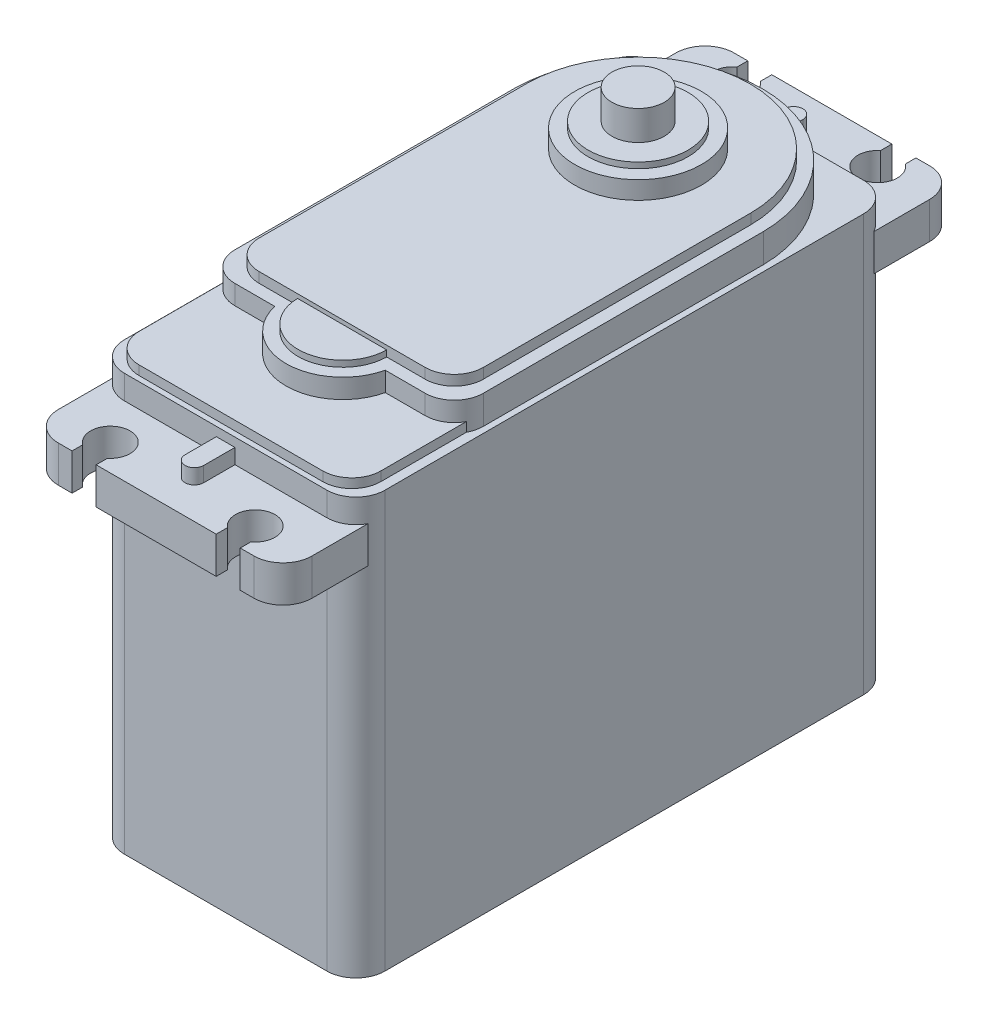
from build123d import *

# Parameters (mm, degrees)
SKETCH1_W            = 58.6486
SKETCH1_H            = 45.5168
BOSS_EXTRUDE1_DEPTH  = 28.4734
BOSS_EXTRUDE2_DEPTH  = 1.016
BOSS_EXTRUDE3_DEPTH  = 2.1209
SKETCH4_W            = 27.7241
SKETCH4_H            = 4.0005
BOSS_EXTRUDE4_DEPTH  = 7.5946
CUT_EXTRUDE1_DEPTH   = 62.365122174
CUT_EXTRUDE2_DEPTH   = 62.365122174
BOSS_EXTRUDE5_DEPTH  = 2.1209
BOSS_EXTRUDE6_DEPTH  = 1.6383
BOSS_EXTRUDE7_DEPTH  = 1.1176
BOSS_EXTRUDE8_DEPTH  = 0.6731
SKETCH11_W           = 7.4422
SKETCH11_H           = 3.4798
BOSS_EXTRUDE9_DEPTH  = 6.1214
BOSS_EXTRUDE9_TAPER  = 10
SKETCH12_W           = 27.7241
SKETCH12_H           = 4.0005
BOSS_EXTRUDE10_DEPTH = 7.5946
SKETCH13_W           = 2.159
SKETCH13_H           = 4.0005
SKETCH14_W           = 2.159
SKETCH14_H           = 4.0005
FILLET1_R            = 3.175
FILLET2_R            = 3.175
FILLET3_R            = 3.175
FILLET4_R            = 3.175
FILLET5_R            = 3.175
FILLET6_R            = 3.175
FILLET7_R            = 3.175
FILLET8_R            = 3.175
FILLET9_R            = 3.175
FILLET10_R           = 3.175
FILLET11_R           = 3.175
FILLET12_R           = 3.175


with BuildPart() as part:
    # Sketch1 → Boss-Extrude1 (new body)
    with BuildSketch(Plane(origin=(28.4734, 0, 0), x_dir=(0, 0, -1), z_dir=(1, 0, 0))):
        with Locations((8.645766261, -5.235024912)):
            Rectangle(SKETCH1_W, SKETCH1_H)
    extrude(amount=-BOSS_EXTRUDE1_DEPTH)

    # Sketch2 → Boss-Extrude2 (add)
    with BuildSketch(Plane(origin=(0, 17.523375088, 0), x_dir=(-1, 0, 0), z_dir=(0, 1, 0))):
        with BuildLine():
            Line((-27.4447, 20.100683739), (-1.0287, 20.100683739))
            Line((-1.0287, 20.100683739), (-1.0287, 7.58320464))
            ThreePointArc((-1.0287, 7.58320464), (-0.753850268, 6.863574994), (-0.6604, 6.098933739))
            Line((-0.6604, 6.098933739), (-0.6604, -24.497394688))
            ThreePointArc((-0.6604, -24.497394688), (-3.369851934, -32.532062726), (-10.317940007, -37.392216261))
            Line((-10.317940007, -37.392216261), (-18.155459993, -37.392216261))
            ThreePointArc((-18.155459993, -37.392216261), (-25.103548066, -32.532062726), (-27.813, -24.497394688))
            Line((-27.813, -24.497394688), (-27.813, 6.098933739))
            ThreePointArc((-27.813, 6.098933739), (-27.719549732, 6.863574994), (-27.4447, 7.58320464))
            Line((-27.4447, 7.58320464), (-27.4447, 20.100683739))
        make_face()
    extrude(amount=BOSS_EXTRUDE2_DEPTH)

    # Sketch3 → Boss-Extrude3 (add)
    with BuildSketch(Plane(origin=(0, 18.539375088, 0), x_dir=(-1, 0, 0), z_dir=(0, 1, 0))):
        with BuildLine():
            Line((-0.6604, 6.098933739), (-0.6604, -24.497394688))
            ThreePointArc((-0.6604, -24.497394688), (-14.2367, -37.970066261), (-27.813, -24.497394688))
            Line((-27.813, -24.497394688), (-27.813, 6.098933739))
            ThreePointArc((-27.813, 6.098933739), (-26.88306403, 8.343997769), (-24.638, 9.273933739))
            Line((-24.638, 9.273933739), (-3.8354, 9.273933739))
            ThreePointArc((-3.8354, 9.273933739), (-1.59033597, 8.343997769), (-0.6604, 6.098933739))
        make_face()
    extrude(amount=BOSS_EXTRUDE3_DEPTH)

    # Sketch4 → Boss-Extrude4 (add)
    with BuildSketch(Plane.XY.offset(20.678533739)):
        with Locations((14.2367, 12.906925088)):
            Rectangle(SKETCH4_W, SKETCH4_H)
    extrude(amount=BOSS_EXTRUDE4_DEPTH)

    # Sketch5 → Cut-Extrude1 (cut, through all)
    with BuildSketch(Plane.XZ.offset(-10.906675088)):
        with BuildLine():
            Line((7.67715, 28.273133739), (5.04825, 28.273133739))
            Line((5.04825, 28.273133739), (5.04825, 27.110795078))
            ThreePointArc((5.04825, 27.110795078), (6.374292493, 27.523106251), (7.67715, 27.042532099))
            Line((7.67715, 27.042532099), (7.67715, 28.273133739))
        make_face()
    cut_extrude1 = extrude(amount=-CUT_EXTRUDE1_DEPTH, mode=Mode.SUBTRACT)

    # Sketch6 → Cut-Extrude2 (cut, through all)
    with BuildSketch(Plane.XZ.offset(-10.906675088)):
        with BuildLine():
            Line((23.42515, 28.273133739), (20.79625, 28.273133739))
            Line((20.79625, 28.273133739), (20.79625, 27.042532099))
            ThreePointArc((20.79625, 27.042532099), (22.099107507, 27.523106251), (23.42515, 27.110795078))
            Line((23.42515, 27.110795078), (23.42515, 28.273133739))
        make_face()
    cut_extrude2 = extrude(amount=-CUT_EXTRUDE2_DEPTH, mode=Mode.SUBTRACT)

    # Sketch7 → Boss-Extrude5 (add)
    with BuildSketch(Plane(origin=(0, 18.539375088, 0), x_dir=(-1, 0, 0), z_dir=(0, 1, 0))):
        with BuildLine():
            Line((-8.19860123, 9.273933739), (-20.27479877, 9.273933739))
            ThreePointArc((-20.27479877, 9.273933739), (-14.2367, 14.074533739), (-8.19860123, 9.273933739))
        make_face()
    extrude(amount=BOSS_EXTRUDE5_DEPTH)

    # Sketch8 → Boss-Extrude6 (add)
    with BuildSketch(Plane(origin=(0, 14.907175088, 0), x_dir=(-1, 0, 0), z_dir=(0, 1, 0))):
        with BuildLine():
            Line((-13.2207, 24.094833739), (-13.2207, 20.678533739))
            Line((-13.2207, 20.678533739), (-15.2527, 20.678533739))
            Line((-15.2527, 20.678533739), (-15.2527, 24.094833739))
            ThreePointArc((-15.2527, 24.094833739), (-14.2367, 25.110833739), (-13.2207, 24.094833739))
        make_face()
    boss_extrude6 = extrude(amount=BOSS_EXTRUDE6_DEPTH)

    # Sketch9 → Boss-Extrude7 (add)
    with BuildSketch(Plane(origin=(0, 20.660275088, 0), x_dir=(-1, 0, 0), z_dir=(0, 1, 0))):
        with BuildLine():
            Line((-26.48585, -24.492179461), (-26.48585, 7.946783739))
            Line((-26.48585, 7.946783739), (-1.98755, 7.946783739))
            Line((-1.98755, 7.946783739), (-1.98755, -24.492179461))
            ThreePointArc((-1.98755, -24.492179461), (-14.2367, -36.642916261), (-26.48585, -24.492179461))
        make_face()
    extrude(amount=BOSS_EXTRUDE7_DEPTH)

    # Sketch10 → Boss-Extrude8 (add)
    with BuildSketch(Plane(origin=(0, 20.660275088, 0), x_dir=(-1, 0, 0), z_dir=(0, 1, 0))):
        with BuildLine():
            Line((-9.366750906, 7.946783739), (-19.106649094, 7.946783739))
            ThreePointArc((-19.106649094, 7.946783739), (-14.2367, 12.747383739), (-9.366750906, 7.946783739))
        make_face()
    extrude(amount=BOSS_EXTRUDE8_DEPTH)

    # Sketch11 → Boss-Extrude9 (add)
    with BuildSketch(Plane(origin=(0, 0, -37.970066261), x_dir=(-1, 0, 0), z_dir=(0, 0, -1))):
        with Locations((-14.2367, -22.684824912)):
            Rectangle(SKETCH11_W, SKETCH11_H)
    extrude(amount=BOSS_EXTRUDE9_DEPTH, taper=BOSS_EXTRUDE9_TAPER)

    # Sketch12 → Boss-Extrude10 (add)
    with BuildSketch(Plane(origin=(0, 0, -37.970066261), x_dir=(-1, 0, 0), z_dir=(0, 0, -1))):
        with Locations((-14.2367, 12.906925088)):
            Rectangle(SKETCH12_W, SKETCH12_H)
    extrude(amount=BOSS_EXTRUDE10_DEPTH)

    # Sketch13 → Cut-Revolve1 (revolve, cut)
    with BuildSketch(Plane.XY.offset(25.364833739)):
        with Locations((7.39775, 12.906925088)):
            Rectangle(SKETCH13_W, SKETCH13_H)
    cut_revolve1 = revolve(axis=Axis((6.31825, 14.907175088, 25.364833739), (0, -1, 0)), mode=Mode.SUBTRACT)

    # Sketch14 → Cut-Revolve2 (revolve, cut)
    with BuildSketch(Plane.XY.offset(25.364833739)):
        with Locations((23.23465, 12.906925088)):
            Rectangle(SKETCH14_W, SKETCH14_H)
    cut_revolve2 = revolve(axis=Axis((22.15515, 14.907175088, 25.364833739), (0, -1, 0)), mode=Mode.SUBTRACT)

    # Sketch15 → Revolve1 (revolve)
    with BuildSketch(Plane.XY.offset(-24.393367719)):
        Polygon((17.0942, 27.594475088), (14.2367, 27.594475088), (14.2367, 21.777875088), (21.16455, 21.777875088), (21.16455, 23.733675088), (19.6977, 23.733675088), (19.6977, 24.368675088), (17.0942, 24.368675088), align=None)
    revolve(axis=Axis((14.2367, 27.594475088, -24.393367719), (0, -1, 0)))

    # Fillet1
    fillet1_edges = [part.edges().sort_by_distance(p)[0] for p in [
        (27.4447, 18.031375088, 20.100683739),
    ]]
    fillet(fillet1_edges, radius=FILLET1_R)

    # Fillet2
    fillet2_edges = [part.edges().sort_by_distance(p)[0] for p in [
        (1.0287, 18.031375088, 20.100683739),
    ]]
    fillet(fillet2_edges, radius=FILLET2_R)

    # Fillet3
    # the kernel refuses this fillet: 3.175 mm, written as the material it takes off along each edge
    with BuildSketch(Plane(origin=(0, -35.930924912, -37.970066261), x_dir=(1, 0, 0), z_dir=(0, 1, 0))) as fillet3_piece_1_section:
        with BuildLine():
            CenterArc((FILLET3_R, -FILLET3_R), FILLET3_R, 90, 90)
            Line((0, -FILLET3_R), (0, 0))
            Line((0, 0), (FILLET3_R, 0))
        make_face()
    fillet3_piece_1 = extrude(amount=61.3918, mode=Mode.PRIVATE)
    fillet3_piece_1 = split(fillet3_piece_1, bisect_by=Plane(origin=(1.118801035, 10.906675088, -37.559986199), z_dir=(0, -1, 0)), keep=Keep.TOP, mode=Mode.PRIVATE)
    fillet3_piece_1 = split(fillet3_piece_1, bisect_by=Plane(origin=(0.37465, -12.512124912, -37.559986199), z_dir=(1, 0, 0)), keep=Keep.TOP, mode=Mode.PRIVATE)
    add(fillet3_piece_1, mode=Mode.SUBTRACT)
    with BuildSketch(Plane(origin=(0, -35.930924912, -37.970066261), x_dir=(1, 0, 0), z_dir=(0, 1, 0))) as fillet3_piece_2_section:
        with BuildLine():
            CenterArc((FILLET3_R, -FILLET3_R), FILLET3_R, 90, 90)
            Line((0, -FILLET3_R), (0, 0))
            Line((0, 0), (FILLET3_R, 0))
        make_face()
    fillet3_piece_2 = extrude(amount=61.3918, mode=Mode.PRIVATE)
    fillet3_piece_2 = split(fillet3_piece_2, bisect_by=Plane(origin=(0.130694491, 10.906675088, -36.797348053), z_dir=(0, -1, 0)), keep=Keep.TOP, mode=Mode.PRIVATE)
    fillet3_piece_2 = split(fillet3_piece_2, bisect_by=Plane(origin=(0.37465, -12.512124912, -36.797348053), z_dir=(-1, 0, 0)), keep=Keep.TOP, mode=Mode.PRIVATE)
    add(fillet3_piece_2, mode=Mode.SUBTRACT)
    with BuildSketch(Plane(origin=(0, -35.930924912, -37.970066261), x_dir=(1, 0, 0), z_dir=(0, 1, 0))) as fillet3_piece_3_section:
        with BuildLine():
            CenterArc((FILLET3_R, -FILLET3_R), FILLET3_R, 90, 90)
            Line((0, -FILLET3_R), (0, 0))
            Line((0, 0), (FILLET3_R, 0))
        make_face()
    fillet3_piece_3 = extrude(amount=61.3918, mode=Mode.PRIVATE)
    fillet3_piece_3 = split(fillet3_piece_3, bisect_by=Plane(origin=(0.130694491, 10.906675088, -36.797348053), z_dir=(0, 1, 0)), keep=Keep.TOP, mode=Mode.PRIVATE)
    fillet3_piece_3 = split(fillet3_piece_3, bisect_by=Plane(origin=(0.37465, 12.906925088, -36.797348053), z_dir=(-1, 0, 0)), keep=Keep.TOP, mode=Mode.PRIVATE)
    fillet3_piece_3 = split(fillet3_piece_3, bisect_by=Plane(origin=(0.130694491, 14.907175088, -36.797348053), z_dir=(0, -1, 0)), keep=Keep.TOP, mode=Mode.PRIVATE)
    add(fillet3_piece_3, mode=Mode.SUBTRACT)
    with BuildSketch(Plane(origin=(0, -35.930924912, -37.970066261), x_dir=(1, 0, 0), z_dir=(0, 1, 0))) as fillet3_piece_4_section:
        with BuildLine():
            CenterArc((FILLET3_R, -FILLET3_R), FILLET3_R, 90, 90)
            Line((0, -FILLET3_R), (0, 0))
            Line((0, 0), (FILLET3_R, 0))
        make_face()
    fillet3_piece_4 = extrude(amount=61.3918, mode=Mode.PRIVATE)
    fillet3_piece_4 = split(fillet3_piece_4, bisect_by=Plane(origin=(0.37465, 20.184025088, -37.559986199), z_dir=(1, 0, 0)), keep=Keep.TOP, mode=Mode.PRIVATE)
    fillet3_piece_4 = split(fillet3_piece_4, bisect_by=Plane(origin=(1.118801035, 14.907175088, -37.559986199), z_dir=(0, 1, 0)), keep=Keep.TOP, mode=Mode.PRIVATE)
    add(fillet3_piece_4, mode=Mode.SUBTRACT)
    with BuildSketch(Plane(origin=(0, -35.930924912, -37.970066261), x_dir=(1, 0, 0), z_dir=(0, 1, 0))) as fillet3_piece_5_section:
        with BuildLine():
            CenterArc((FILLET3_R, -FILLET3_R), FILLET3_R, 90, 90)
            Line((0, -FILLET3_R), (0, 0))
            Line((0, 0), (FILLET3_R, 0))
        make_face()
    fillet3_piece_5 = extrude(amount=61.3918, mode=Mode.PRIVATE)
    fillet3_piece_5 = split(fillet3_piece_5, bisect_by=Plane(origin=(0.37465, 20.184025088, -36.797348053), z_dir=(-1, 0, 0)), keep=Keep.TOP, mode=Mode.PRIVATE)
    fillet3_piece_5 = split(fillet3_piece_5, bisect_by=Plane(origin=(0.130694491, 14.907175088, -36.797348053), z_dir=(0, 1, 0)), keep=Keep.TOP, mode=Mode.PRIVATE)
    add(fillet3_piece_5, mode=Mode.SUBTRACT)

    # Fillet4
    fillet4_edges = [part.edges().sort_by_distance(p)[0] for p in [
        (0.37465, 12.906925088, 28.273133739),
    ]]
    fillet(fillet4_edges, radius=FILLET4_R)

    # Fillet5
    # the kernel refuses this fillet: 3.175 mm, written as the material it takes off along each edge
    with BuildSketch(Plane(origin=(28.4734, -35.930924912, -37.970066261), x_dir=(0, 0, 1), z_dir=(0, 1, 0))) as fillet5_piece_1_section:
        with BuildLine():
            CenterArc((FILLET5_R, -FILLET5_R), FILLET5_R, 90, 90)
            Line((0, -FILLET5_R), (0, 0))
            Line((0, 0), (FILLET5_R, 0))
        make_face()
    fillet5_piece_1 = extrude(amount=61.3918, mode=Mode.PRIVATE)
    fillet5_piece_1 = split(fillet5_piece_1, bisect_by=Plane(origin=(28.09875, -12.512124912, -36.797348053), z_dir=(1, 0, 0)), keep=Keep.TOP, mode=Mode.PRIVATE)
    fillet5_piece_1 = split(fillet5_piece_1, bisect_by=Plane(origin=(28.342705509, 10.906675088, -36.797348053), z_dir=(0, -1, 0)), keep=Keep.TOP, mode=Mode.PRIVATE)
    add(fillet5_piece_1, mode=Mode.SUBTRACT)
    with BuildSketch(Plane(origin=(28.4734, -35.930924912, -37.970066261), x_dir=(0, 0, 1), z_dir=(0, 1, 0))) as fillet5_piece_2_section:
        with BuildLine():
            CenterArc((FILLET5_R, -FILLET5_R), FILLET5_R, 90, 90)
            Line((0, -FILLET5_R), (0, 0))
            Line((0, 0), (FILLET5_R, 0))
        make_face()
    fillet5_piece_2 = extrude(amount=61.3918, mode=Mode.PRIVATE)
    fillet5_piece_2 = split(fillet5_piece_2, bisect_by=Plane(origin=(28.09875, -12.512124912, -37.559986199), z_dir=(-1, 0, 0)), keep=Keep.TOP, mode=Mode.PRIVATE)
    fillet5_piece_2 = split(fillet5_piece_2, bisect_by=Plane(origin=(27.354598965, 10.906675088, -37.559986199), z_dir=(0, -1, 0)), keep=Keep.TOP, mode=Mode.PRIVATE)
    add(fillet5_piece_2, mode=Mode.SUBTRACT)
    with BuildSketch(Plane(origin=(28.4734, -35.930924912, -37.970066261), x_dir=(0, 0, 1), z_dir=(0, 1, 0))) as fillet5_piece_3_section:
        with BuildLine():
            CenterArc((FILLET5_R, -FILLET5_R), FILLET5_R, 90, 90)
            Line((0, -FILLET5_R), (0, 0))
            Line((0, 0), (FILLET5_R, 0))
        make_face()
    fillet5_piece_3 = extrude(amount=61.3918, mode=Mode.PRIVATE)
    fillet5_piece_3 = split(fillet5_piece_3, bisect_by=Plane(origin=(28.342705509, 14.907175088, -36.797348053), z_dir=(0, -1, 0)), keep=Keep.TOP, mode=Mode.PRIVATE)
    fillet5_piece_3 = split(fillet5_piece_3, bisect_by=Plane(origin=(28.09875, 12.906925088, -36.797348053), z_dir=(1, 0, 0)), keep=Keep.TOP, mode=Mode.PRIVATE)
    fillet5_piece_3 = split(fillet5_piece_3, bisect_by=Plane(origin=(28.342705509, 10.906675088, -36.797348053), z_dir=(0, 1, 0)), keep=Keep.TOP, mode=Mode.PRIVATE)
    add(fillet5_piece_3, mode=Mode.SUBTRACT)
    with BuildSketch(Plane(origin=(28.4734, -35.930924912, -37.970066261), x_dir=(0, 0, 1), z_dir=(0, 1, 0))) as fillet5_piece_4_section:
        with BuildLine():
            CenterArc((FILLET5_R, -FILLET5_R), FILLET5_R, 90, 90)
            Line((0, -FILLET5_R), (0, 0))
            Line((0, 0), (FILLET5_R, 0))
        make_face()
    fillet5_piece_4 = extrude(amount=61.3918, mode=Mode.PRIVATE)
    fillet5_piece_4 = split(fillet5_piece_4, bisect_by=Plane(origin=(28.342705509, 14.907175088, -36.797348053), z_dir=(0, 1, 0)), keep=Keep.TOP, mode=Mode.PRIVATE)
    fillet5_piece_4 = split(fillet5_piece_4, bisect_by=Plane(origin=(28.09875, 20.184025088, -36.797348053), z_dir=(1, 0, 0)), keep=Keep.TOP, mode=Mode.PRIVATE)
    add(fillet5_piece_4, mode=Mode.SUBTRACT)
    with BuildSketch(Plane(origin=(28.4734, -35.930924912, -37.970066261), x_dir=(0, 0, 1), z_dir=(0, 1, 0))) as fillet5_piece_5_section:
        with BuildLine():
            CenterArc((FILLET5_R, -FILLET5_R), FILLET5_R, 90, 90)
            Line((0, -FILLET5_R), (0, 0))
            Line((0, 0), (FILLET5_R, 0))
        make_face()
    fillet5_piece_5 = extrude(amount=61.3918, mode=Mode.PRIVATE)
    fillet5_piece_5 = split(fillet5_piece_5, bisect_by=Plane(origin=(27.354598965, 14.907175088, -37.559986199), z_dir=(0, 1, 0)), keep=Keep.TOP, mode=Mode.PRIVATE)
    fillet5_piece_5 = split(fillet5_piece_5, bisect_by=Plane(origin=(28.09875, 20.184025088, -37.559986199), z_dir=(-1, 0, 0)), keep=Keep.TOP, mode=Mode.PRIVATE)
    add(fillet5_piece_5, mode=Mode.SUBTRACT)

    # Fillet6
    fillet6_edges = [part.edges().sort_by_distance(p)[0] for p in [
        (1.98755, 21.219075088, 7.946783739),
    ]]
    fillet(fillet6_edges, radius=FILLET6_R)

    # Fillet7
    # the kernel refuses this fillet: 3.175 mm, written as the material it takes off along each edge
    with BuildSketch(Plane(origin=(28.4734, 25.460875088, 20.678533739), x_dir=(0, 0, -1), z_dir=(0, -1, 0))) as fillet7_piece_1_section:
        with BuildLine():
            CenterArc((FILLET7_R, -FILLET7_R), FILLET7_R, 90, 90)
            Line((0, -FILLET7_R), (0, 0))
            Line((0, 0), (FILLET7_R, 0))
        make_face()
    fillet7_piece_1 = extrude(amount=61.3918, mode=Mode.PRIVATE)
    fillet7_piece_1 = split(fillet7_piece_1, bisect_by=Plane(origin=(28.09875, 20.184025088, 19.505815531), z_dir=(1, 0, 0)), keep=Keep.TOP, mode=Mode.PRIVATE)
    fillet7_piece_1 = split(fillet7_piece_1, bisect_by=Plane(origin=(28.342705509, 14.907175088, 19.505815531), z_dir=(0, 1, 0)), keep=Keep.TOP, mode=Mode.PRIVATE)
    add(fillet7_piece_1, mode=Mode.SUBTRACT)
    with BuildSketch(Plane(origin=(28.4734, 25.460875088, 20.678533739), x_dir=(0, 0, -1), z_dir=(0, -1, 0))) as fillet7_piece_2_section:
        with BuildLine():
            CenterArc((FILLET7_R, -FILLET7_R), FILLET7_R, 90, 90)
            Line((0, -FILLET7_R), (0, 0))
            Line((0, 0), (FILLET7_R, 0))
        make_face()
    fillet7_piece_2 = extrude(amount=61.3918, mode=Mode.PRIVATE)
    fillet7_piece_2 = split(fillet7_piece_2, bisect_by=Plane(origin=(28.09875, 20.184025088, 20.268453676), z_dir=(-1, 0, 0)), keep=Keep.TOP, mode=Mode.PRIVATE)
    fillet7_piece_2 = split(fillet7_piece_2, bisect_by=Plane(origin=(27.354598965, 14.907175088, 20.268453676), z_dir=(0, 1, 0)), keep=Keep.TOP, mode=Mode.PRIVATE)
    add(fillet7_piece_2, mode=Mode.SUBTRACT)
    with BuildSketch(Plane(origin=(28.4734, 25.460875088, 20.678533739), x_dir=(0, 0, -1), z_dir=(0, -1, 0))) as fillet7_piece_3_section:
        with BuildLine():
            CenterArc((FILLET7_R, -FILLET7_R), FILLET7_R, 90, 90)
            Line((0, -FILLET7_R), (0, 0))
            Line((0, 0), (FILLET7_R, 0))
        make_face()
    fillet7_piece_3 = extrude(amount=61.3918, mode=Mode.PRIVATE)
    fillet7_piece_3 = split(fillet7_piece_3, bisect_by=Plane(origin=(28.09875, 12.906925088, 19.505815531), z_dir=(1, 0, 0)), keep=Keep.TOP, mode=Mode.PRIVATE)
    fillet7_piece_3 = split(fillet7_piece_3, bisect_by=Plane(origin=(28.342705509, 14.907175088, 19.505815531), z_dir=(0, -1, 0)), keep=Keep.TOP, mode=Mode.PRIVATE)
    fillet7_piece_3 = split(fillet7_piece_3, bisect_by=Plane(origin=(28.342705509, 10.906675088, 19.505815531), z_dir=(0, 1, 0)), keep=Keep.TOP, mode=Mode.PRIVATE)
    add(fillet7_piece_3, mode=Mode.SUBTRACT)
    with BuildSketch(Plane(origin=(28.4734, 25.460875088, 20.678533739), x_dir=(0, 0, -1), z_dir=(0, -1, 0))) as fillet7_piece_4_section:
        with BuildLine():
            CenterArc((FILLET7_R, -FILLET7_R), FILLET7_R, 90, 90)
            Line((0, -FILLET7_R), (0, 0))
            Line((0, 0), (FILLET7_R, 0))
        make_face()
    fillet7_piece_4 = extrude(amount=61.3918, mode=Mode.PRIVATE)
    fillet7_piece_4 = split(fillet7_piece_4, bisect_by=Plane(origin=(28.09875, -12.512124912, 19.505815531), z_dir=(1, 0, 0)), keep=Keep.TOP, mode=Mode.PRIVATE)
    fillet7_piece_4 = split(fillet7_piece_4, bisect_by=Plane(origin=(28.342705509, 10.906675088, 19.505815531), z_dir=(0, -1, 0)), keep=Keep.TOP, mode=Mode.PRIVATE)
    add(fillet7_piece_4, mode=Mode.SUBTRACT)
    with BuildSketch(Plane(origin=(28.4734, 25.460875088, 20.678533739), x_dir=(0, 0, -1), z_dir=(0, -1, 0))) as fillet7_piece_5_section:
        with BuildLine():
            CenterArc((FILLET7_R, -FILLET7_R), FILLET7_R, 90, 90)
            Line((0, -FILLET7_R), (0, 0))
            Line((0, 0), (FILLET7_R, 0))
        make_face()
    fillet7_piece_5 = extrude(amount=61.3918, mode=Mode.PRIVATE)
    fillet7_piece_5 = split(fillet7_piece_5, bisect_by=Plane(origin=(28.09875, -12.512124912, 20.268453676), z_dir=(-1, 0, 0)), keep=Keep.TOP, mode=Mode.PRIVATE)
    fillet7_piece_5 = split(fillet7_piece_5, bisect_by=Plane(origin=(27.354598965, 10.906675088, 20.268453676), z_dir=(0, -1, 0)), keep=Keep.TOP, mode=Mode.PRIVATE)
    add(fillet7_piece_5, mode=Mode.SUBTRACT)

    # Fillet8
    # the kernel refuses this fillet: 3.175 mm, written as the material it takes off along each edge
    with BuildSketch(Plane(origin=(0, 25.460875088, 20.678533739), x_dir=(1, 0, 0), z_dir=(0, -1, 0))) as fillet8_piece_1_section:
        with BuildLine():
            CenterArc((FILLET8_R, -FILLET8_R), FILLET8_R, 90, 90)
            Line((0, -FILLET8_R), (0, 0))
            Line((0, 0), (FILLET8_R, 0))
        make_face()
    fillet8_piece_1 = extrude(amount=61.3918, mode=Mode.PRIVATE)
    fillet8_piece_1 = split(fillet8_piece_1, bisect_by=Plane(origin=(1.118801035, 14.907175088, 20.268453676), z_dir=(0, 1, 0)), keep=Keep.TOP, mode=Mode.PRIVATE)
    fillet8_piece_1 = split(fillet8_piece_1, bisect_by=Plane(origin=(0.37465, 20.184025088, 20.268453676), z_dir=(1, 0, 0)), keep=Keep.TOP, mode=Mode.PRIVATE)
    add(fillet8_piece_1, mode=Mode.SUBTRACT)
    with BuildSketch(Plane(origin=(0, 25.460875088, 20.678533739), x_dir=(1, 0, 0), z_dir=(0, -1, 0))) as fillet8_piece_2_section:
        with BuildLine():
            CenterArc((FILLET8_R, -FILLET8_R), FILLET8_R, 90, 90)
            Line((0, -FILLET8_R), (0, 0))
            Line((0, 0), (FILLET8_R, 0))
        make_face()
    fillet8_piece_2 = extrude(amount=61.3918, mode=Mode.PRIVATE)
    fillet8_piece_2 = split(fillet8_piece_2, bisect_by=Plane(origin=(0.130694491, 14.907175088, 19.505815531), z_dir=(0, 1, 0)), keep=Keep.TOP, mode=Mode.PRIVATE)
    fillet8_piece_2 = split(fillet8_piece_2, bisect_by=Plane(origin=(0.37465, 20.184025088, 19.505815531), z_dir=(-1, 0, 0)), keep=Keep.TOP, mode=Mode.PRIVATE)
    add(fillet8_piece_2, mode=Mode.SUBTRACT)
    with BuildSketch(Plane(origin=(0, 25.460875088, 20.678533739), x_dir=(1, 0, 0), z_dir=(0, -1, 0))) as fillet8_piece_3_section:
        with BuildLine():
            CenterArc((FILLET8_R, -FILLET8_R), FILLET8_R, 90, 90)
            Line((0, -FILLET8_R), (0, 0))
            Line((0, 0), (FILLET8_R, 0))
        make_face()
    fillet8_piece_3 = extrude(amount=61.3918, mode=Mode.PRIVATE)
    fillet8_piece_3 = split(fillet8_piece_3, bisect_by=Plane(origin=(0.130694491, 14.907175088, 19.505815531), z_dir=(0, -1, 0)), keep=Keep.TOP, mode=Mode.PRIVATE)
    fillet8_piece_3 = split(fillet8_piece_3, bisect_by=Plane(origin=(0.37465, 12.906925088, 19.505815531), z_dir=(-1, 0, 0)), keep=Keep.TOP, mode=Mode.PRIVATE)
    fillet8_piece_3 = split(fillet8_piece_3, bisect_by=Plane(origin=(0.130694491, 10.906675088, 19.505815531), z_dir=(0, 1, 0)), keep=Keep.TOP, mode=Mode.PRIVATE)
    add(fillet8_piece_3, mode=Mode.SUBTRACT)
    with BuildSketch(Plane(origin=(0, 25.460875088, 20.678533739), x_dir=(1, 0, 0), z_dir=(0, -1, 0))) as fillet8_piece_4_section:
        with BuildLine():
            CenterArc((FILLET8_R, -FILLET8_R), FILLET8_R, 90, 90)
            Line((0, -FILLET8_R), (0, 0))
            Line((0, 0), (FILLET8_R, 0))
        make_face()
    fillet8_piece_4 = extrude(amount=61.3918, mode=Mode.PRIVATE)
    fillet8_piece_4 = split(fillet8_piece_4, bisect_by=Plane(origin=(0.37465, -12.512124912, 20.268453676), z_dir=(1, 0, 0)), keep=Keep.TOP, mode=Mode.PRIVATE)
    fillet8_piece_4 = split(fillet8_piece_4, bisect_by=Plane(origin=(1.118801035, 10.906675088, 20.268453676), z_dir=(0, -1, 0)), keep=Keep.TOP, mode=Mode.PRIVATE)
    add(fillet8_piece_4, mode=Mode.SUBTRACT)
    with BuildSketch(Plane(origin=(0, 25.460875088, 20.678533739), x_dir=(1, 0, 0), z_dir=(0, -1, 0))) as fillet8_piece_5_section:
        with BuildLine():
            CenterArc((FILLET8_R, -FILLET8_R), FILLET8_R, 90, 90)
            Line((0, -FILLET8_R), (0, 0))
            Line((0, 0), (FILLET8_R, 0))
        make_face()
    fillet8_piece_5 = extrude(amount=61.3918, mode=Mode.PRIVATE)
    fillet8_piece_5 = split(fillet8_piece_5, bisect_by=Plane(origin=(0.37465, -12.512124912, 19.505815531), z_dir=(-1, 0, 0)), keep=Keep.TOP, mode=Mode.PRIVATE)
    fillet8_piece_5 = split(fillet8_piece_5, bisect_by=Plane(origin=(0.130694491, 10.906675088, 19.505815531), z_dir=(0, -1, 0)), keep=Keep.TOP, mode=Mode.PRIVATE)
    add(fillet8_piece_5, mode=Mode.SUBTRACT)

    # Fillet9
    fillet9_edges = [part.edges().sort_by_distance(p)[0] for p in [
        (0.37465, 12.906925088, -45.564666261),
    ]]
    fillet(fillet9_edges, radius=FILLET9_R)

    # Fillet10
    fillet10_edges = [part.edges().sort_by_distance(p)[0] for p in [
        (28.09875, 12.906925088, -45.564666261),
    ]]
    fillet(fillet10_edges, radius=FILLET10_R)

    # Fillet11
    fillet11_edges = [part.edges().sort_by_distance(p)[0] for p in [
        (26.48585, 21.219075088, 7.946783739),
    ]]
    fillet(fillet11_edges, radius=FILLET11_R)

    # Fillet12
    fillet12_edges = [part.edges().sort_by_distance(p)[0] for p in [
        (28.09875, 12.906925088, 28.273133739),
    ]]
    fillet(fillet12_edges, radius=FILLET12_R)

    # Mirror1: Cut-Extrude1, Cut-Extrude2, Boss-Extrude6, Cut-Revolve1, Cut-Revolve2 across plane
    add(cut_extrude1.mirror(Plane.XY.offset(-8.645766261)), mode=Mode.SUBTRACT)
    add(cut_extrude2.mirror(Plane.XY.offset(-8.645766261)), mode=Mode.SUBTRACT)
    add(boss_extrude6.mirror(Plane.XY.offset(-8.645766261)))
    add(cut_revolve1.mirror(Plane.XY.offset(-8.645766261)), mode=Mode.SUBTRACT)
    add(cut_revolve2.mirror(Plane.XY.offset(-8.645766261)), mode=Mode.SUBTRACT)


solid = part.part
